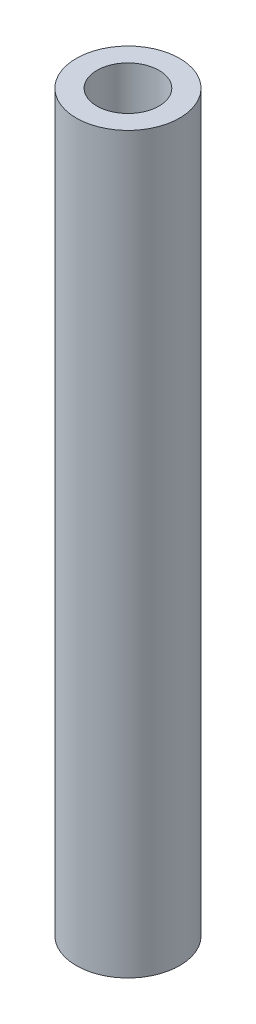
from build123d import *

# Parameters (mm, degrees)
SKETCH1_R      = 2.5
SKETCH1_R_2    = 1.5
STANDOFF_DEPTH = 35.5


with BuildPart() as part:
    # Sketch1 → standoff (new body)
    with BuildSketch(Plane(origin=(0, 0, 0), x_dir=(1, 0, 0), z_dir=(0, 1, 0))):
        Circle(SKETCH1_R)
        Circle(SKETCH1_R_2, mode=Mode.SUBTRACT)
    extrude(amount=STANDOFF_DEPTH)


solid = part.part
